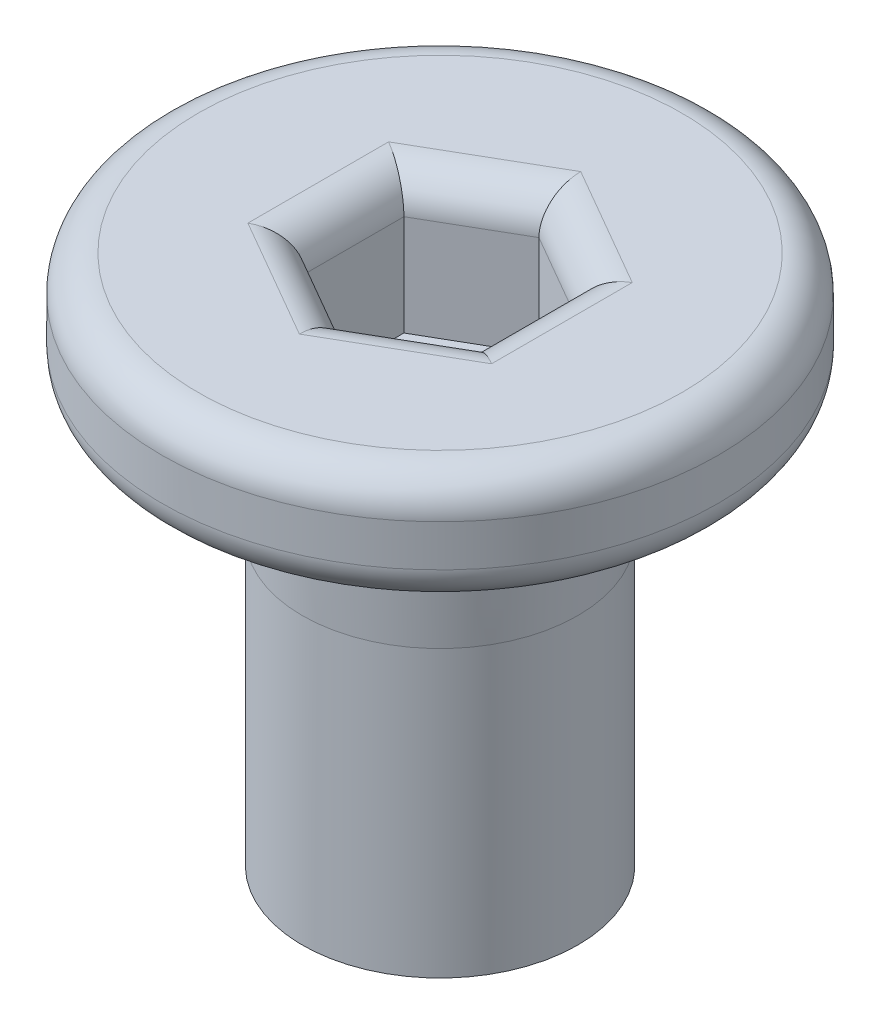
from build123d import *

# Parameters (mm, degrees)
FILLET1_R          = 0.635
CUT_EXTRUDE1_DEPTH = 2.4
FILLET2_R          = 0.635


with BuildPart() as part:
    # Sketch2 → Revolve1 (revolve)
    with BuildSketch(Plane.XY):
        Polygon((0, 4.65), (4.875, 4.65), (4.875, 2.65), (2.5, 2.65), (2.413, 0.35), (2.413, -4.65), (0, -4.65), align=None)
    revolve(axis=Axis((0, -4.65, 0), (0, 1, 0)))

    # Fillet1
    fillet1_edges = [part.edges().sort_by_distance(p)[0] for p in [
        (-2.5, 2.65, 0),
        (-4.875, 4.65, 0),
        (-4.875, 2.65, 0),
    ]]
    fillet(fillet1_edges, radius=FILLET1_R)

    # Sketch3 → Cut-Extrude1 (cut)
    with BuildSketch(Plane(origin=(0, 4.65, 0), x_dir=(1, 0, 0), z_dir=(0, 1, 0))):
        Polygon((0, 1.732050808), (-1.5, 0.866025404), (-1.5, -0.866025404), (0, -1.732050808), (1.5, -0.866025404), (1.5, 0.866025404), align=None)
    extrude(amount=-CUT_EXTRUDE1_DEPTH, mode=Mode.SUBTRACT)

    # Fillet2
    fillet2_edges = [part.edges().sort_by_distance(p)[0] for p in [
        (-0.75, 4.65, -1.299038106),
        (-1.5, 4.65, 0),
        (-0.75, 4.65, 1.299038106),
        (0.75, 4.65, 1.299038106),
        (1.5, 4.65, 0),
        (0.75, 4.65, -1.299038106),
    ]]
    fillet(fillet2_edges, radius=FILLET2_R)


solid = part.part
